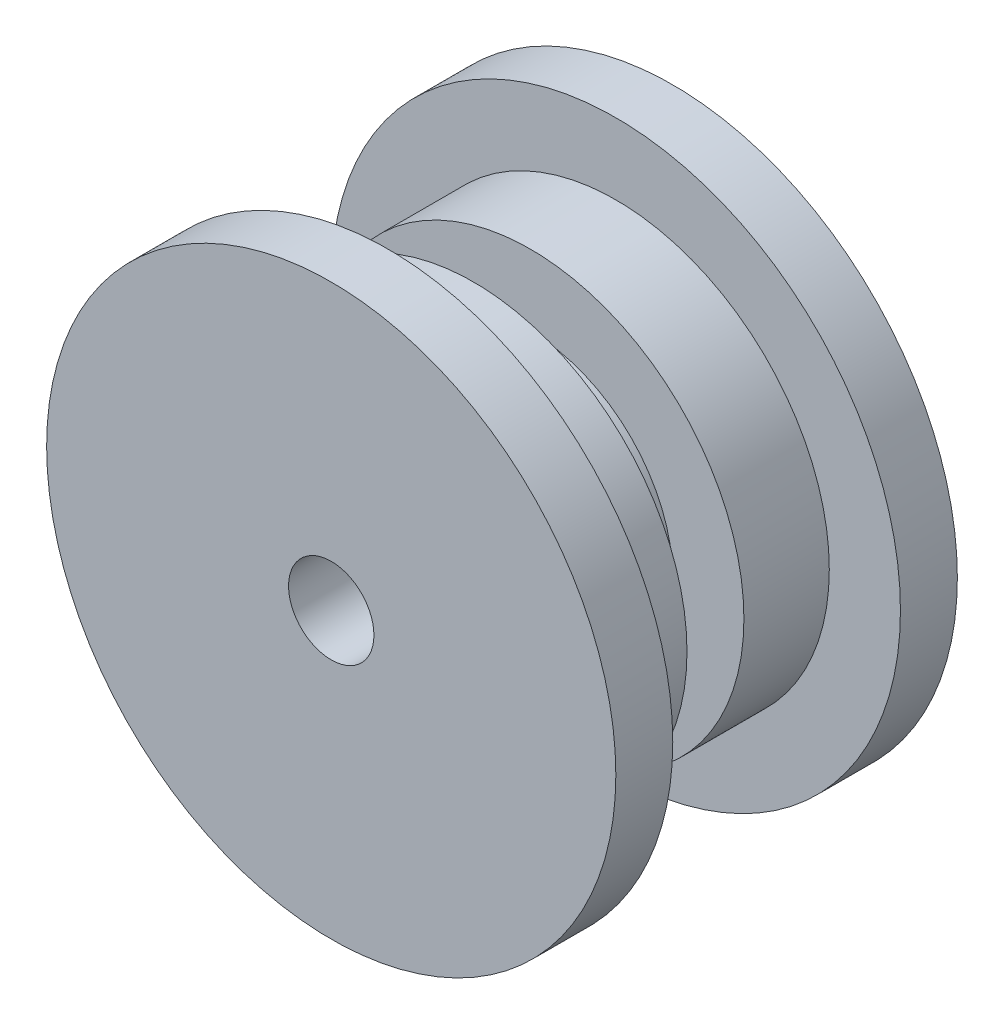
from build123d import *

# Parameters (mm, degrees)
SKETCH_1_R          = 10
EXTRUDE_1_DEPTH     = 2
SKETCH_2_R          = 7.5
EXTRUDE_2_DEPTH     = 3
SKETCH_3_R          = 5
EXTRUDE_3_DEPTH     = 2
SKETCH_4_R          = 7.5
EXTRUDE_4_DEPTH     = 3
SKETCH_5_R          = 10
EXTRUDE_5_DEPTH     = 2
SKETCH_6_R          = 1.5
CUT_EXTRUDE_1_DEPTH = 22


with BuildPart() as part:
    # 草图1 → 凸台-拉伸1 (new body)
    with BuildSketch(Plane.XY):
        Circle(SKETCH_1_R)
    extrude(amount=EXTRUDE_1_DEPTH)

    # 草图2 → 凸台-拉伸2 (add)
    with BuildSketch(Plane.XY.offset(2)):
        Circle(SKETCH_2_R)
    extrude(amount=EXTRUDE_2_DEPTH)

    # 草图3 → 凸台-拉伸3 (add)
    with BuildSketch(Plane.XY.offset(5)):
        Circle(SKETCH_3_R)
    extrude(amount=EXTRUDE_3_DEPTH)

    # 草图4 → 凸台-拉伸4 (add)
    with BuildSketch(Plane.XY.offset(7)):
        Circle(SKETCH_4_R)
    extrude(amount=EXTRUDE_4_DEPTH)

    # 草图5 → 凸台-拉伸5 (add)
    with BuildSketch(Plane.XY.offset(10)):
        Circle(SKETCH_5_R)
    extrude(amount=EXTRUDE_5_DEPTH)

    # 草图6 → 切除-拉伸1 (cut)
    with BuildSketch(Plane(origin=(0, 0, 0), x_dir=(-1, 0, 0), z_dir=(0, 0, -1))):
        Circle(SKETCH_6_R)
    extrude(amount=-CUT_EXTRUDE_1_DEPTH, mode=Mode.SUBTRACT)


solid = part.part
